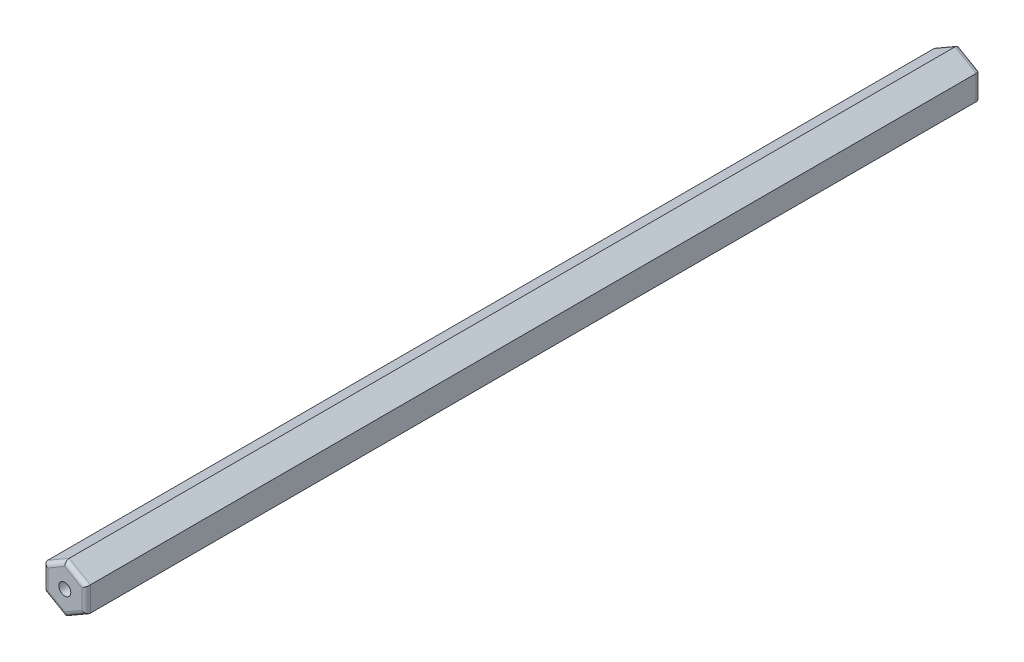
from build123d import *

# Parameters (mm, degrees)
RESSALTO_EXTRUS_O1_DEPTH = 105
FILETE1_R                = 0.5
ESBO_O2_R                = 0.701481341
CORTE_EXTRUS_O1_DEPTH    = 120.749018558


with BuildPart() as part:
    # Esboço1 → Ressalto-extrusão1 (new body)
    with BuildSketch(Plane.XY.offset(135)):
        Polygon((-55.002122675, 2.886751346), (-57.502122675, 1.443375673), (-57.502122675, -1.443375673), (-55.002122675, -2.886751346), (-52.502122675, -1.443375673), (-52.502122675, 1.443375673), align=None)
    extrude(amount=-RESSALTO_EXTRUS_O1_DEPTH)

    # Filete1
    filete1_edges = [part.edges().sort_by_distance(p)[0] for p in [
        (-53.752122675, -2.165063509, 135),
        (-56.252122675, -2.165063509, 135),
        (-52.502122675, 0, 135),
        (-57.502122675, 0, 135),
        (-53.752122675, 2.165063509, 135),
        (-56.252122675, 2.165063509, 135),
        (-53.752122675, -2.165063509, 30),
        (-56.252122675, -2.165063509, 30),
        (-52.502122675, 0, 30),
        (-57.502122675, 0, 30),
        (-53.752122675, 2.165063509, 30),
        (-56.252122675, 2.165063509, 30),
    ]]
    fillet(filete1_edges, radius=FILETE1_R)

    # Esboço2 → Corte-extrusão1 (cut, through all)
    with BuildSketch(Plane.XY.offset(135)):
        with Locations((-55.002122675, 0)):
            Circle(ESBO_O2_R)
    extrude(amount=-CORTE_EXTRUS_O1_DEPTH, mode=Mode.SUBTRACT)


solid = part.part
